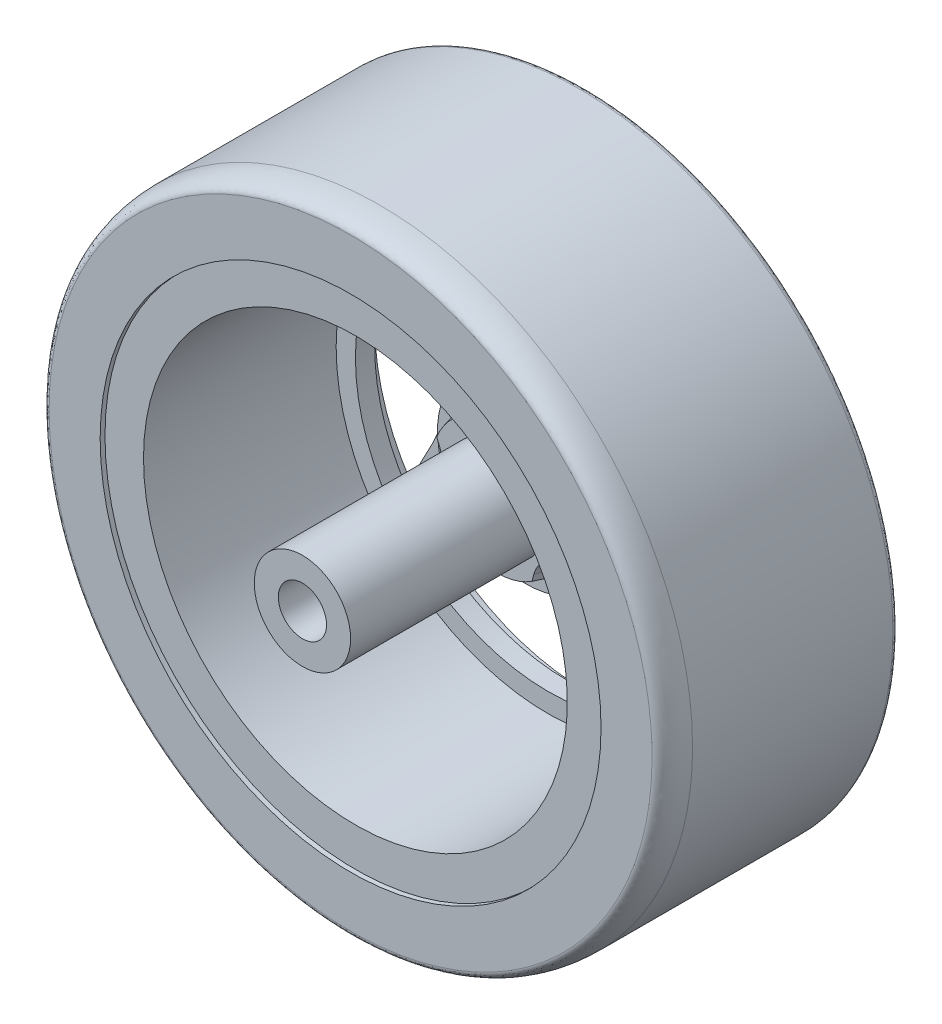
from build123d import *

# Parameters (mm, degrees)
SKETCH1_R           = 32.5
SKETCH1_R_2         = 26
BOSS_EXTRUDE1_DEPTH = 25
BOSS_EXTRUDE3_DEPTH = 0.7
FILLET1_SIZE        = 0.7
FILLET1_SIZE_2      = 1.2
SKETCH4_R           = 11
BOSS_EXTRUDE4_DEPTH = 5
BOSS_EXTRUDE4_TAPER = 20
SKETCH5_R           = 8.5
CUT_EXTRUDE2_DEPTH  = 3
CUT_EXTRUDE2_DRAFT  = -20
SKETCH6_R           = 4
BOSS_EXTRUDE5_DEPTH = 2
SKETCH7_R           = 0.5
BOSS_EXTRUDE6_DEPTH = 1
FILLET2_R           = 0.2
BOSS_EXTRUDE7_DEPTH = 3
BOSS_EXTRUDE7_TAPER = 15
SKETCH9_R           = 5
BOSS_EXTRUDE8_DEPTH = 20.2
FILLET3_SIZE        = 3
FILLET3_SIZE_2      = 1.2
SKETCH11_R          = 2.5
CUT_EXTRUDE3_DEPTH  = 15
SCALE1_SCALE        = 2


with BuildPart() as part:
    # Sketch1 → Boss-Extrude1 (new body)
    with BuildSketch(Plane.XY):
        Circle(SKETCH1_R)
        Circle(SKETCH1_R_2, mode=Mode.SUBTRACT)
    extrude(amount=BOSS_EXTRUDE1_DEPTH)

    # Sketch2 → Revolve1 (revolve)
    with BuildSketch(Plane(origin=(0, 0, 0), x_dir=(0, 0, -1), z_dir=(1, 0, 0)), mode=Mode.PRIVATE) as revolve1_sk:
        Polygon((-24.5, 22), (-4.5, 22), (-4.5, 20), (-2.5, 20), (-2.5, 22), (-0.5, 22), (-0.5, 26), (-24.5, 26), align=None)
    revolve(revolve1_sk.sketch.rotate(Axis((0, 0, 0), (0, 0, 1)), 90), axis=Axis((0, 0, 0), (0, 0, 1)))


with BuildPart() as body_2:
    # Sketch3 → Boss-Extrude3 (new body)
    with BuildSketch(Plane(origin=(0, 0, 2.5), x_dir=(-1, 0, 0), z_dir=(0, 0, -1))):
        with BuildLine():
            ThreePointArc((-3.813636678, 21.666937377), (-5.319018913, 21.347319218), (-6.798373876, 20.923243358))
            Line((-6.798373876, 20.923243358), (-8, 12.692086512))
            ThreePointArc((-8, 12.692086512), (-9.743842293, 8.717190667), (-13.275471522, 6.193626145))
            Line((-13.275471522, 6.193626145), (-21.784960524, 3.068467852))
            ThreePointArc((-21.784960524, 3.068467852), (-21.946174285, 1.537996825), (-22, 0))
            Line((-22, 0), (-14.543027537, -3.686381704))
            ThreePointArc((-14.543027537, -3.686381704), (-11.301553847, -6.573184647), (-9.992834813, -10.711787963))
            Line((-9.992834813, -10.711787963), (-9.65020937, -19.770519951))
            ThreePointArc((-9.65020937, -19.770519951), (-8.244462718, -20.396784906), (-6.798373876, -20.923243358))
            Line((-6.798373876, -20.923243358), (-0.988085317, -14.9703957))
            ThreePointArc((-0.988085317, -14.9703957), (2.75909789, -12.779642193), (7.099559964, -12.813875186))
            Line((7.099559964, -12.813875186), (15.820803135, -15.287321157))
            ThreePointArc((15.820803135, -15.287321157), (16.850816106, -14.143903158), (17.798373876, -12.93127555))
            Line((17.798373876, -12.93127555), (13.932357227, -5.565831664))
            ThreePointArc((13.932357227, -5.565831664), (13.006770121, -1.325068593), (14.380604176, 2.79237757))
            Line((14.380604176, 2.79237757), (19.428003437, 10.322435879))
            ThreePointArc((19.428003437, 10.322435879), (18.65883981, 11.65537202), (17.798373876, 12.93127555))
            Line((17.798373876, 12.93127555), (9.598755627, 11.530522557))
            ThreePointArc((9.598755627, 11.530522557), (5.279528129, 11.960704766), (1.788142196, 14.539659434))
            Line((1.788142196, 14.539659434), (-3.813636678, 21.666937377))
        make_face()
    extrude(amount=BOSS_EXTRUDE3_DEPTH)

    # Fillet1
    # an asymmetric fillet: 1.2, 0.7 mm, written as the material it takes off along each edge
    with BuildSketch(Plane(origin=(0, 0, 1.8), x_dir=(-0.6179885957105321, -0.7861870614374955, 0), z_dir=(0.7861870614374955, -0.6179885957105321, 0))) as fillet1_piece_1:
        with BuildLine():
            Bezier((22, -FILLET1_SIZE), (22, 0), (22 - FILLET1_SIZE_2, 0), weights=[1, 0.707106781, 1])
            Line((22 - FILLET1_SIZE_2, 0), (22, 0))
            Line((22, 0), (22, -FILLET1_SIZE))
        make_face()
    revolve(axis=Axis((0, 0, 1.8), (0, 0, -1)), revolution_arc=23.643686347, mode=Mode.SUBTRACT)
    with BuildSketch(Plane(origin=(0, 0, 1.8), x_dir=(0.5567393494025945, -0.8306872436884869, 0), z_dir=(0.8306872436884869, 0.5567393494025945, 0))) as fillet1_piece_2:
        with BuildLine():
            Bezier((22, -FILLET1_SIZE), (22, 0), (22 - FILLET1_SIZE_2, 0), weights=[1, 0.707106781, 1])
            Line((22 - FILLET1_SIZE_2, 0), (22, 0))
            Line((22, 0), (22, -FILLET1_SIZE))
        make_face()
    revolve(axis=Axis((0, 0, 1.8), (0, 0, -1)), revolution_arc=23.643686347, mode=Mode.SUBTRACT)
    with BuildSketch(Plane(origin=(0, 0, 1.8), x_dir=(0.9620724365158486, 0.272794110817038, 0), z_dir=(-0.272794110817038, 0.9620724365158486, 0))) as fillet1_piece_3:
        with BuildLine():
            Bezier((22, -FILLET1_SIZE), (22, 0), (22 - FILLET1_SIZE_2, 0), weights=[1, 0.707106781, 1])
            Line((22 - FILLET1_SIZE_2, 0), (22, 0))
            Line((22, 0), (22, -FILLET1_SIZE))
        make_face()
    revolve(axis=Axis((0, 0, 1.8), (0, 0, -1)), revolution_arc=23.643686347, mode=Mode.SUBTRACT)
    with BuildSketch(Plane(origin=(0, 0, 1.8), x_dir=(0.03785411600362055, 0.9992832761042209, 0), z_dir=(-0.9992832761042209, 0.03785411600362055, 0))) as fillet1_piece_4:
        with BuildLine():
            Bezier((22, -FILLET1_SIZE), (22, 0), (22 - FILLET1_SIZE_2, 0), weights=[1, 0.707106781, 1])
            Line((22 - FILLET1_SIZE_2, 0), (22, 0))
            Line((22, 0), (22, -FILLET1_SIZE))
        make_face()
    revolve(axis=Axis((0, 0, 1.8), (0, 0, -1)), revolution_arc=23.643686347, mode=Mode.SUBTRACT)
    with BuildSketch(Plane(origin=(0, 0, 1.8), x_dir=(-0.9386773062115137, 0.34479691820475444, 0), z_dir=(-0.34479691820475444, -0.9386773062115137, 0))) as fillet1_piece_5:
        with BuildLine():
            Bezier((22, -FILLET1_SIZE), (22, 0), (22 - FILLET1_SIZE_2, 0), weights=[1, 0.707106781, 1])
            Line((22 - FILLET1_SIZE_2, 0), (22, 0))
            Line((22, 0), (22, -FILLET1_SIZE))
        make_face()
    revolve(axis=Axis((0, 0, 1.8), (0, 0, -1)), revolution_arc=23.643686347, mode=Mode.SUBTRACT)

    # Combine1: union part
    add(part.part)

    # Sketch4 → Boss-Extrude4 (add)
    with BuildSketch(Plane.XY.offset(1.8)):
        Circle(SKETCH4_R)
    extrude(amount=BOSS_EXTRUDE4_DEPTH, taper=BOSS_EXTRUDE4_TAPER)


with BuildPart() as cut_extrude2_tool:
    # Sketch5 → Cut-Extrude2 (with draft: the straight prism first)
    with BuildSketch(Plane(origin=(0, 0, 1.8), x_dir=(-1, 0, 0), z_dir=(0, 0, -1))):
        Circle(SKETCH5_R)
    extrude(amount=-CUT_EXTRUDE2_DEPTH)
    # Cut-Extrude2: the draft: its side faces are tilted about the plane it starts from
    cut_extrude2_sides = [cut_extrude2_tool.faces().sort_by_distance(p)[0] for p in [
        (8.5, 0, 3.3),
    ]]
    draft(cut_extrude2_sides, Plane(origin=(0, 0, 1.8), x_dir=(-1, 0, 0), z_dir=(0, 0, -1)), CUT_EXTRUDE2_DRAFT)


with BuildPart() as body_2_1:
    add(body_2.part)

    # Cut-Extrude2: cut by cut_extrude2_tool
    add(cut_extrude2_tool.part, mode=Mode.SUBTRACT)

    # Sketch6 → Boss-Extrude5 (add)
    with BuildSketch(Plane(origin=(0, 0, 4.8), x_dir=(-1, 0, 0), z_dir=(0, 0, -1))):
        Circle(SKETCH6_R)
    extrude(amount=BOSS_EXTRUDE5_DEPTH)

    # Sketch7 → Boss-Extrude6 (add)
    with BuildSketch(Plane(origin=(0, 0, 4.8), x_dir=(-1, 0, 0), z_dir=(0, 0, -1))):
        with Locations((0, -5.5)):
            Circle(SKETCH7_R)
        with Locations((5.5, 0)):
            Circle(SKETCH7_R)
        with Locations((0, 5.5)):
            Circle(SKETCH7_R)
        with Locations((-5.5, 0)):
            Circle(SKETCH7_R)
    extrude(amount=BOSS_EXTRUDE6_DEPTH)

    # Fillet2
    fillet2_edges = [body_2_1.edges().sort_by_distance(p)[0] for p in [
        (4, 0, 2.8),
        (0.5, 5.5, 3.8),
        (6, 0, 3.8),
        (-5, 0, 3.8),
        (0.5, -5.5, 3.8),
    ]]
    fillet(fillet2_edges, radius=FILLET2_R)

    # Sketch8 → Boss-Extrude7 (add)
    with BuildSketch(Plane.XY.offset(6.8)):
        with BuildLine():
            ThreePointArc((-3.340537458, 6.714969061), (-5.657514963, 4.923669815), (-7.111820732, 2.381597337))
            Line((-7.111820732, 2.381597337), (-6.712641645, 1.416337212))
            ThreePointArc((-6.712641645, 1.416337212), (-6.584381076, 0.579842489), (-6.856862841, -0.221361532))
            Line((-6.856862841, -0.221361532), (-7.418597927, -1.10200036))
            ThreePointArc((-7.418597927, -1.10200036), (-6.430956531, -3.859118824), (-4.462707133, -6.027789399))
            Line((-4.462707133, -6.027789399), (-3.42133708, -5.94642931))
            ThreePointArc((-3.42133708, -5.94642931), (-2.586148627, -6.082937345), (-1.908359818, -6.589668562))
            Line((-1.908359818, -6.589668562), (-1.24440821, -7.39604274))
            ThreePointArc((-1.24440821, -7.39604274), (1.682965247, -7.308736415), (4.353716042, -6.106976062))
            Line((4.353716042, -6.106976062), (4.598139042, -5.091432637))
            ThreePointArc((4.598139042, -5.091432637), (4.986053325, -4.339304519), (5.67743161, -3.851277613))
            Line((5.67743161, -3.851277613), (6.649511357, -3.469005435))
            ThreePointArc((6.649511357, -3.469005435), (7.471086255, -0.657928695), (7.153451625, 2.253470624))
            Line((7.153451625, 2.253470624), (6.263143293, 2.799750889))
            ThreePointArc((6.263143293, 2.799750889), (5.667699052, 3.401099665), (5.417205522, 4.209448096))
            Line((5.417205522, 4.209448096), (5.354032238, 5.252079474))
            ThreePointArc((5.354032238, 5.252079474), (2.934419992, 6.902114119), (0.067360199, 7.499697501))
            Line((0.067360199, 7.499697501), (-0.727303611, 6.821773846))
            ThreePointArc((-0.727303611, 6.821773846), (-1.483222673, 6.441299711), (-2.329414474, 6.452859611))
            Line((-2.329414474, 6.452859611), (-3.340537458, 6.714969061))
        make_face()
    extrude(amount=BOSS_EXTRUDE7_DEPTH, taper=BOSS_EXTRUDE7_TAPER)

    # Sketch9 → Boss-Extrude8 (add)
    with BuildSketch(Plane.XY.offset(9.8)):
        Circle(SKETCH9_R)
    extrude(amount=BOSS_EXTRUDE8_DEPTH)

    # Fillet3
    # an asymmetric fillet: 3, 1.2 mm, written as the material it takes off along each edge
    with BuildSketch(Plane(origin=(0, 0, 0), x_dir=(1, 0, 0), z_dir=(0, -1, 0))) as fillet3_piece_1:
        with BuildLine():
            Bezier((32.5 - FILLET3_SIZE, 0), (32.5, 0), (32.5, FILLET3_SIZE_2), weights=[1, 0.707106781, 1])
            Line((32.5, FILLET3_SIZE_2), (32.5, 0))
            Line((32.5, 0), (32.5 - FILLET3_SIZE, 0))
        make_face()
    revolve(axis=Axis((0, 0, 0), (0, 0, 1)), mode=Mode.SUBTRACT)
    with BuildSketch(Plane(origin=(0, 0, 25), x_dir=(1, 0, 0), z_dir=(0, -1, 0))) as fillet3_piece_2:
        with BuildLine():
            Bezier((32.5, -FILLET3_SIZE), (32.5, 0), (32.5 - FILLET3_SIZE_2, 0), weights=[1, 0.707106781, 1])
            Line((32.5 - FILLET3_SIZE_2, 0), (32.5, 0))
            Line((32.5, 0), (32.5, -FILLET3_SIZE))
        make_face()
    revolve(axis=Axis((0, 0, 25), (0, 0, 1)), mode=Mode.SUBTRACT)

    # Sketch11 → Cut-Extrude3 (cut)
    with BuildSketch(Plane.XY.offset(30)):
        Circle(SKETCH11_R)
    extrude(amount=-CUT_EXTRUDE3_DEPTH, mode=Mode.SUBTRACT)


with BuildPart() as body_2_2:
    # Scale1: scaled about (0, 1e-09, 12.287236733)
    add(body_2_1.part.scale(SCALE1_SCALE).moved(Location((0, -1e-09, -12.287236733))))


solid = body_2_2.part
